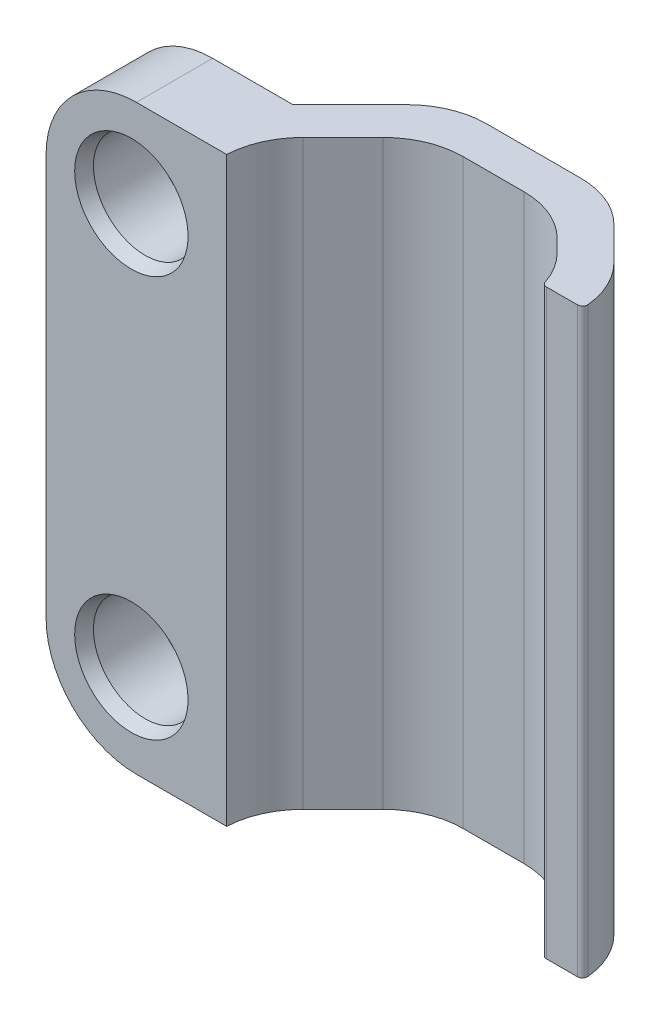
from build123d import *

# Parameters (mm, degrees)
BOSS_EXTRUDE1_DEPTH     = 29
CUT_EXTRUDE1_DEPTH      = 39.173943993
CUT_EXTRUDE1_DEPTH_BACK = 39.173943993
SKETCH2_R               = 2.575
FILLET1_R               = 4.5
FILLET2_R               = 4
CHAMFER1_SIZE           = 0.25
CHAMFER1_SIZE2          = 0.686869355
FILLET4_R               = 0.25


with BuildPart() as part:
    # Sketch1 → Boss-Extrude1 (new body)
    with BuildSketch(Plane(origin=(0, 0, 0), x_dir=(1, 0, 0), z_dir=(0, 1, 0))):
        Polygon((0, 0), (0, 3.8), (8.5, 3.8), (12.5, 7.8), (20.5, 7.8), (24.5, 3.8), (24.5, 2.25), (22.5, 2.25), (22.5, 2.971572875), (19.671572875, 5.8), (13.328427125, 5.8), (9, 1.471572875), (9, 0), align=None)
    extrude(amount=BOSS_EXTRUDE1_DEPTH)

    # Sketch2 → Cut-Extrude1 (cut, two sides: drawn at the far end of the back side and taken through both)
    with BuildSketch(Plane(origin=(0, 0, -3.8), x_dir=(-1, 0, 0), z_dir=(0, 0, -1)).offset(-CUT_EXTRUDE1_DEPTH_BACK)):
        with Locations((-4.25, 4.5)):
            Circle(SKETCH2_R)
        with Locations((-4.25, 24.5)):
            Circle(SKETCH2_R)
    extrude(amount=CUT_EXTRUDE1_DEPTH + CUT_EXTRUDE1_DEPTH_BACK, mode=Mode.SUBTRACT)

    # Fillet1
    fillet1_edges = [part.edges().sort_by_distance(p)[0] for p in [
        (0, 0, -1.9),
        (0, 29, -1.9),
    ]]
    fillet(fillet1_edges, radius=FILLET1_R)

    # Fillet2
    # the kernel refuses this fillet: 4 mm, written as the material it adds along each edge
    with BuildSketch(Plane(origin=(9, 0, -1.471572875), x_dir=(0, 0, 1), z_dir=(0, 1, 0))) as fillet2_piece_1:
        with BuildLine():
            CenterArc((1.66135914, 3.99549511), FILLET2_R, 225, 42.280491011)
            Line((-1.167067985, 1.167067985), (-1.223636528, 1.110499443))
            Line((-1.223636528, 1.110499443), (-0.056568542, -0.056568542))
            Line((-0.056568542, -0.056568542), (0, -0.08))
            ThreePointArc((0, -0.08), (0.735786438, -0.08), (1.46777715, -0.079909902))
            Line((1.46777715, -0.079909902), (1.471572875, 0))
        make_face()
    extrude(amount=29)
    with BuildSketch(Plane(origin=(19.671572875, 0, -5.8), x_dir=(-1, 0, 0), z_dir=(0, 1, 0)), Plane(origin=(13.328427125, 0, -5.8), x_dir=(-0.7071067811865457, 0, 0.7071067811865493), z_dir=(0, 1, 0))) as fillet2_piece_2:
        with BuildLine():
            CenterArc((FILLET2_R * 0.414213562373, FILLET2_R), FILLET2_R, 225, 45)
            Line((-FILLET2_R * 0.292893218813, FILLET2_R * 0.292893218813), (-FILLET2_R * 0.307035354437, FILLET2_R * 0.27875108319))
            Line((-FILLET2_R * 0.307035354437, FILLET2_R * 0.27875108319), (-FILLET2_R * 0.00828427124746, -FILLET2_R * 0.02))
            Line((-FILLET2_R * 0.00828427124746, -FILLET2_R * 0.02), (FILLET2_R * 0.414213562373, -FILLET2_R * 0.02))
            Line((FILLET2_R * 0.414213562373, -FILLET2_R * 0.02), (FILLET2_R * 0.414213562373, 0))
        make_face()
    extrude(amount=29)
    with BuildSketch(Plane(origin=(22.5, 0, -2.971572875), x_dir=(-0.7071067811865455, 0, -0.7071067811865495), z_dir=(0, 1, 0))) as fillet2_piece_3:
        with BuildLine():
            CenterArc((1.444636364, 4), FILLET2_R, 240.743753532, 29.256246468)
            Line((-0.510229073, 0.510229073), (-0.549326382, 0.440433655))
            ThreePointArc((-0.549326382, 0.440433655), (-0.311683079, 0.198545994), (-0.056568542, -0.056568542))
            Line((-0.056568542, -0.056568542), (0, -0.08))
            Line((0, -0.08), (1.444636364, -0.08))
            Line((1.444636364, -0.08), (1.444636364, 0))
        make_face()
    extrude(amount=29)
    # the kernel refuses this fillet: 4 mm, written as the material it takes off along each edge
    with BuildSketch(Plane(origin=(20.5, -4.142135624, -7.8), x_dir=(0.7071067811865446, 0, 0.7071067811865505), z_dir=(0, 1, 0))) as fillet2_2_piece_1:
        with BuildLine():
            CenterArc((FILLET2_R * 0.414213562373, -FILLET2_R), FILLET2_R, 90, 45)
            Line((-FILLET2_R * 0.292893218813, -FILLET2_R * 0.292893218813), (-FILLET2_R * 0.307035354437, -FILLET2_R * 0.27875108319))
            Line((-FILLET2_R * 0.307035354437, -FILLET2_R * 0.27875108319), (-FILLET2_R * 0.00828427124746, FILLET2_R * 0.02))
            Line((-FILLET2_R * 0.00828427124746, FILLET2_R * 0.02), (FILLET2_R * 0.414213562373, FILLET2_R * 0.02))
            Line((FILLET2_R * 0.414213562373, FILLET2_R * 0.02), (FILLET2_R * 0.414213562373, 0))
        make_face()
    extrude(amount=37.284271247, mode=Mode.SUBTRACT)
    with BuildSketch(Plane(origin=(12.5, -4.142135624, -7.8), x_dir=(-0.7071067811865461, 0, 0.7071067811865489), z_dir=(0, 1, 0))) as fillet2_2_piece_2:
        with BuildLine():
            CenterArc((FILLET2_R * 0.414213562373, FILLET2_R), FILLET2_R, 225, 45)
            Line((-FILLET2_R * 0.292893218813, FILLET2_R * 0.292893218813), (-FILLET2_R * 0.307035354437, FILLET2_R * 0.27875108319))
            Line((-FILLET2_R * 0.307035354437, FILLET2_R * 0.27875108319), (-FILLET2_R * 0.00828427124746, -FILLET2_R * 0.02))
            Line((-FILLET2_R * 0.00828427124746, -FILLET2_R * 0.02), (FILLET2_R * 0.414213562373, -FILLET2_R * 0.02))
            Line((FILLET2_R * 0.414213562373, -FILLET2_R * 0.02), (FILLET2_R * 0.414213562373, 0))
        make_face()
    extrude(amount=37.284271247, mode=Mode.SUBTRACT)
    with BuildSketch(Plane(origin=(24.5, -4.136949157, -3.8), x_dir=(0, 0, 1), z_dir=(0, 1, 0))) as fillet2_2_piece_3:
        with BuildLine():
            CenterArc((1.658321204, -3.998533046), FILLET2_R, 91.551776657, 43.448223343)
            Line((-1.170105921, -1.170105921), (-1.226674463, -1.113537378))
            Line((-1.226674463, -1.113537378), (-0.056568542, 0.056568542))
            Line((-0.056568542, 0.056568542), (0, 0.08))
            ThreePointArc((0, 0.08), (0.775, 0.08), (1.547833576, 0.079970661))
            Line((1.547833576, 0.079970661), (1.55, 0))
        make_face()
    extrude(amount=37.273898313, mode=Mode.SUBTRACT)

    # Chamfer1
    chamfer1_edges = [part.edges().sort_by_distance(p)[0] for p in [
        (6.825, 4.5, 0),
        (6.825, 24.5, 0),
    ]]
    chamfer1_side = [part.faces().sort_by_distance(p)[0] for p in [
        (4.693643045, 14.5, 0),
    ]]
    chamfer(chamfer1_edges, length=CHAMFER1_SIZE, length2=CHAMFER1_SIZE2, reference=chamfer1_side[0])

    # Fillet4
    fillet4_edges = [part.edges().sort_by_distance(p)[0] for p in [
        (24.5, 14.5, -2.25),
        (22.5, 14.5, -2.25),
    ]]
    fillet(fillet4_edges, radius=FILLET4_R)


solid = part.part
